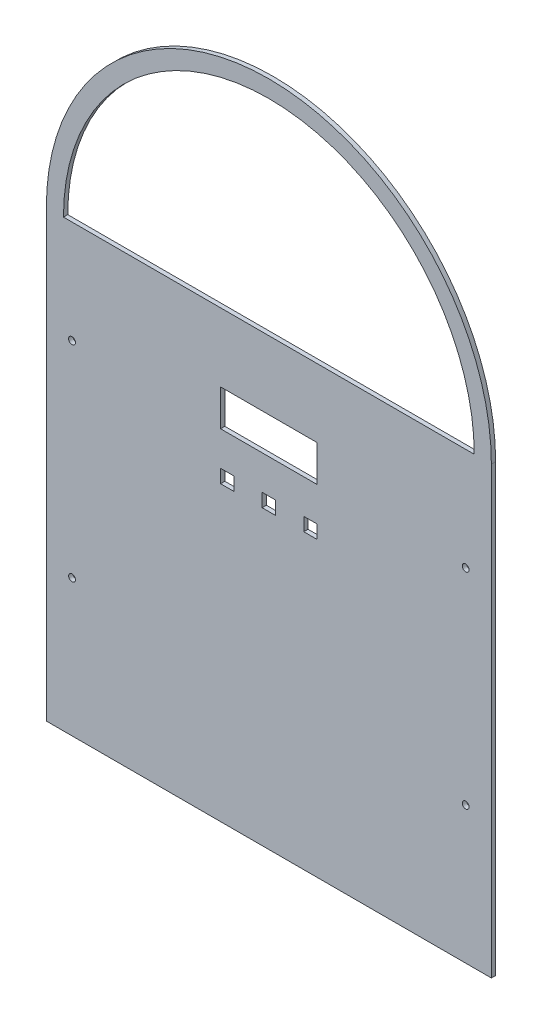
from build123d import *

# Parameters (mm, degrees)
SKETCH1_R           = 2.54
SKETCH1_W           = 71.628
SKETCH1_H           = 26.924
SKETCH1_W_2         = 9.906
SKETCH1_H_2         = 9.906
BOSS_EXTRUDE1_DEPTH = 3.175


with BuildPart() as part:
    # Sketch1 → Boss-Extrude1 (new body)
    with BuildSketch(Plane.XY):
        with BuildLine():
            Line((0, 0), (0, -330.2))
            Line((0, -330.2), (330.2, -330.2))
            Line((330.2, -330.2), (330.2, 0))
            ThreePointArc((330.2, 0), (165.1, 165.1), (0, 0))
        make_face()
        with Locations((19.05, -76.2)):
            Circle(SKETCH1_R, mode=Mode.SUBTRACT)
        with Locations((19.05, -228.6)):
            Circle(SKETCH1_R, mode=Mode.SUBTRACT)
        with Locations((311.15, -76.2)):
            Circle(SKETCH1_R, mode=Mode.SUBTRACT)
        with Locations((311.15, -228.6)):
            Circle(SKETCH1_R, mode=Mode.SUBTRACT)
        with BuildLine():
            Line((12.7, 0), (317.5, 0))
            ThreePointArc((317.5, 0), (165.1, 152.4), (12.7, 0))
        make_face(mode=Mode.SUBTRACT)
        with Locations((165.1, -64.262)):
            Rectangle(SKETCH1_W, SKETCH1_H, mode=Mode.SUBTRACT)
        with Locations((134.239, -108.077)):
            Rectangle(SKETCH1_W_2, SKETCH1_H_2, mode=Mode.SUBTRACT)
        with Locations((165.1, -108.077)):
            Rectangle(SKETCH1_W_2, SKETCH1_H_2, mode=Mode.SUBTRACT)
        with Locations((195.961, -108.077)):
            Rectangle(SKETCH1_W_2, SKETCH1_H_2, mode=Mode.SUBTRACT)
    extrude(amount=BOSS_EXTRUDE1_DEPTH)


solid = part.part
